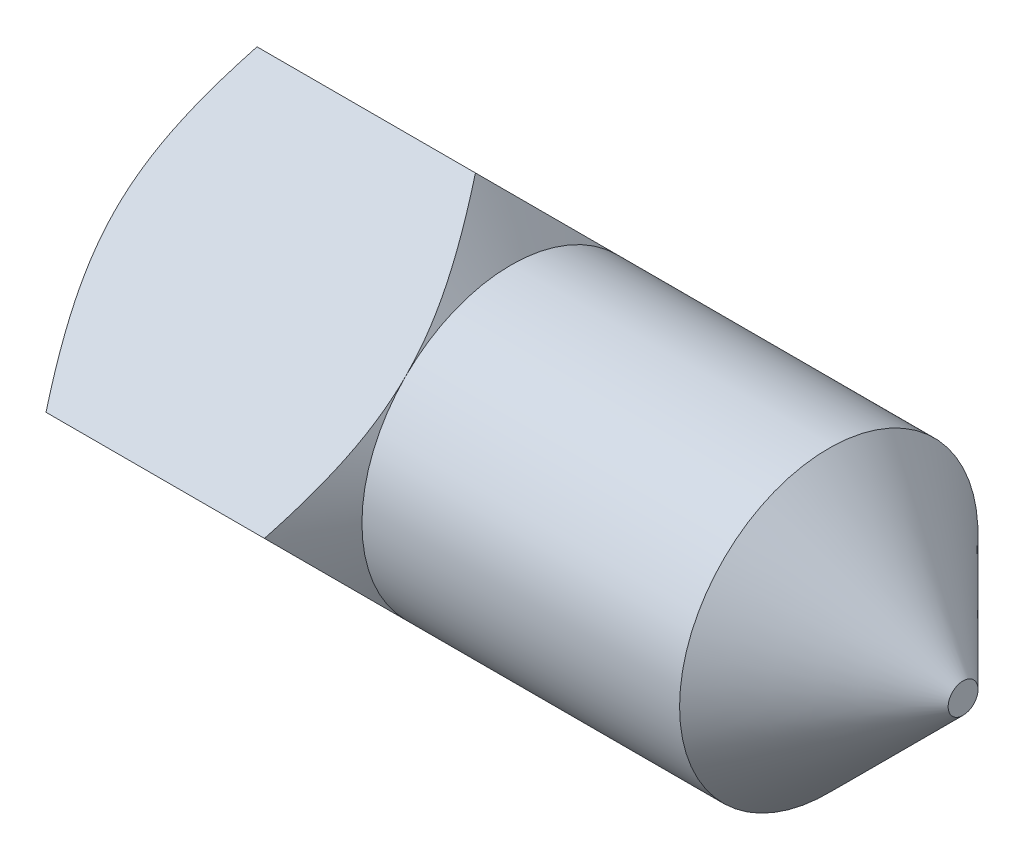
from build123d import *

# Parameters (mm, degrees)
BASEHEAD_DEPTH = 4
BODYSKE_W      = 6.53602765
BODYSKE_H      = 2


with BuildPart() as part:
    # BaseHeadSke → BaseHead (new body)
    with BuildSketch(Plane(origin=(0, 0, 0), x_dir=(0, 0, -1), z_dir=(1, 0, 0))):
        Polygon((0, 2.828427125), (2.828427125, 0), (0, -2.828427125), (-2.828427125, 0), align=None)
    extrude(amount=BASEHEAD_DEPTH)

    # HeadChamferSke → HeadChamfer (revolve, cut)
    with BuildSketch(Plane.XY):
        Polygon((0, 2.828427125), (0, 1.9), (0.53602765, 2.828427125), align=None)
        Polygon((3.46397235, 2.828427125), (4, 1.9), (4, 2.828427125), align=None)
    revolve(axis=Axis((0, 0, 0), (1, 0, 0)), mode=Mode.SUBTRACT)

    # BodySke → BaseBody (revolve)
    with BuildSketch(Plane.XY):
        with Locations((6.731986175, 1)):
            Rectangle(BODYSKE_W, BODYSKE_H)
    revolve(axis=Axis((0, 0, 0), (1, 0, 0)))

    # ChamferEndSke → ChamferEnd (revolve, cut)
    with BuildSketch(Plane.XY):
        Polygon((10, 2), (10, 0.2), (8.2, 2), align=None)
    revolve(axis=Axis((0, 0, 0), (1, 0, 0)), mode=Mode.SUBTRACT)


solid = part.part
